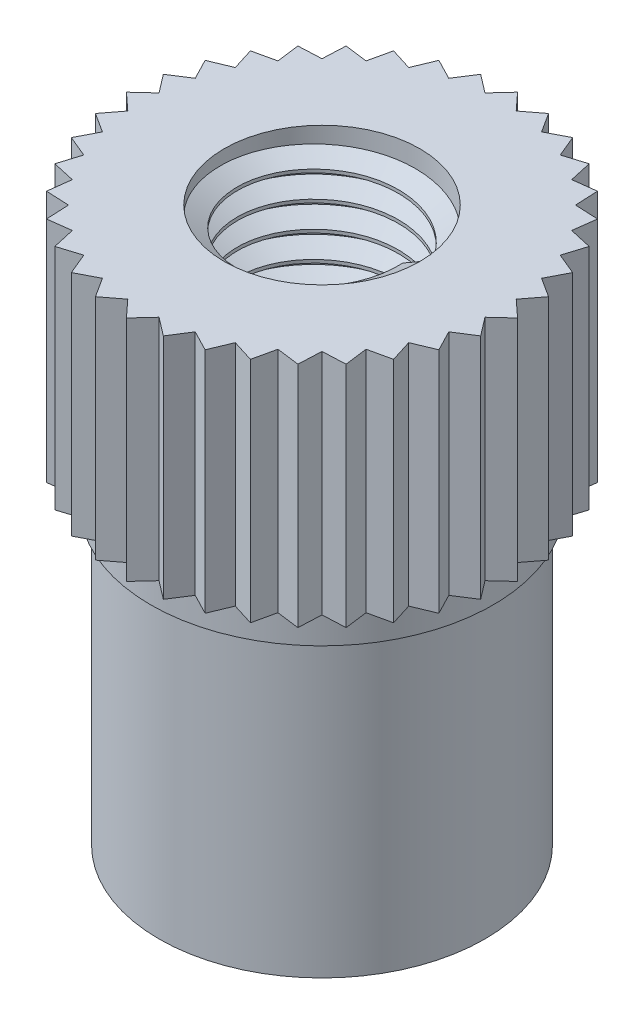
from build123d import *
from build123d.topology import SkipClean

# Parameters (mm, degrees)
CROQUIS2_R                                     = 3
SALIENTE_EXTRUIR1_DEPTH                        = 8.5
CROQUIS2_3_R                                   = 3
CROQUIS2_3_R_2                                 = 2.5
CROQUIS2_3_R_3                                 = 1.5
CORTAR_EXTRUIR1_DEPTH                          = 5
CORTAR_EXTRUIR3_DEPTH                          = 10.5
MATRIZC2_COUNT                                 = 36
CROQUIS5_R                                     = 2.625
SALIENTE_EXTRUIR2_DEPTH                        = 0.5
PERFORADOR_PARA_ROSCAR_PARA_MACHO_DE_ROS_D     = 3
PERFORADOR_PARA_ROSCAR_PARA_MACHO_DE_ROS_DEPTH = 3
BARRER1_PITCH                                  = 0.4


with BuildPart() as part:
    # Croquis2 → Saliente-Extruir1 (new body)
    with BuildSketch(Plane(origin=(0, 0, 0), x_dir=(1, 0, 0), z_dir=(0, 1, 0))):
        with Locations(Location((0, 0, 0), (0, 0, 270))):
            Circle(CROQUIS2_R)
    extrude(amount=SALIENTE_EXTRUIR1_DEPTH)

    # Croquis2<3> → Cortar-Extruir1 (cut)
    # profile 1 of 2: a face of its own
    with BuildSketch(Plane(origin=(0, 0, 0), x_dir=(1, 0, 0), z_dir=(0, 1, 0))):
        with Locations(Location((0, 0, 0), (0, 0, 270))):
            Circle(CROQUIS2_3_R)
        with Locations(Location((0, 0, 0), (0, 0, 270))):
            Circle(CROQUIS2_3_R_2, mode=Mode.SUBTRACT)
    # profile 2 of 2: a face of its own
    with BuildSketch(Plane(origin=(0, 0, 0), x_dir=(1, 0, 0), z_dir=(0, 1, 0))):
        with Locations(Location((0, 0, 0), (0, 0, 270))):
            Circle(CROQUIS2_3_R_3)
    extrude(amount=CORTAR_EXTRUIR1_DEPTH, mode=Mode.SUBTRACT)

    # Croquis4 → Cortar-Extruir3 (cut, through all)
    with BuildSketch(Plane(origin=(0, 8.5, 0), x_dir=(1, 0, 0), z_dir=(0, 1, 0))):
        with BuildLine():
            Line((-3, 0), (-2.73953542, 0.239678293))
            Line((-2.73953542, 0.239678293), (-2.954423259, 0.520944533))
            ThreePointArc((-2.954423259, 0.520944533), (-2.988584094, 0.261467228), (-3, 0))
        make_face()
    cortar_extruir3 = extrude(amount=-CORTAR_EXTRUIR3_DEPTH, mode=Mode.SUBTRACT)

    # MatrizC2: Cortar-Extruir3 ×36 about axis
    matrizc2_axis = Axis((0, 0, 0), (0, 1, 0))
    for i in range(1, MATRIZC2_COUNT):
        add(cortar_extruir3.rotate(matrizc2_axis, i * 360 / MATRIZC2_COUNT), mode=Mode.SUBTRACT)

    # Croquis5 → Saliente-Extruir2 (add)
    with BuildSketch(Plane.XZ.offset(-5)):
        with Locations(Location((0, 0, 0), (0, 0, 90))):
            Circle(CROQUIS5_R)
    extrude(amount=SALIENTE_EXTRUIR2_DEPTH)

    # Perforador para roscar para macho de roscar para M21
    with Locations(Plane(origin=(0, 8.5, 0), x_dir=(1, 0, 0), z_dir=(0, 1, 0))):
        with Locations((0, 0)):
            Hole(PERFORADOR_PARA_ROSCAR_PARA_MACHO_DE_ROS_D / 2, depth=PERFORADOR_PARA_ROSCAR_PARA_MACHO_DE_ROS_DEPTH)

    # Barrer1: the profile of Croquis16 profile screwed along a right-hand helix of 7.5 turns, 6 arcs to a turn; built about Z, then put on its axis
    with SkipClean():  # the faces are left unmerged after this step: merging them gives an invalid solid
        barrer1_z = Axis((0, 0, 0), (0, 0, 1))
        barrer1_corners = [(1.5003, 0, -0.000173205), (1.240192379, 0, 0.15), (1.240192379, 0, 0.2), (1.5003, 0, 0.350173205)]
        with BuildLine(mode=Mode.PRIVATE) as barrer1_profile:
            Line(barrer1_corners[0], barrer1_corners[1])
            Line(barrer1_corners[1], barrer1_corners[2])
            Line(barrer1_corners[2], barrer1_corners[3])
            Line(barrer1_corners[3], barrer1_corners[0])
        barrer1_cap = Face(barrer1_profile.wire())
        barrer1_turn_angles = [0, 30, 60, 90, 120, 150, 180, 210, 240, 270, 300, 330, 360]
        barrer1_turn_weights = [1, 0.8660254037844387, 1, 0.8660254037844387, 1, 0.8660254037844387, 1, 0.8660254037844387, 1, 0.8660254037844387, 1, 0.8660254037844387, 1]
        barrer1_turn_rails = [Edge.make_bspline([Vector(p[0], p[1], 0).rotate(barrer1_z, barrer1_turn_angles[k]) / barrer1_turn_weights[k] + Vector(0, 0, p[2] + BARRER1_PITCH * barrer1_turn_angles[k] / 360) for k in range(13)], [0, 0, 0, 1, 1, 2, 2, 3, 3, 4, 4, 5, 5, 6, 6, 6], 2, barrer1_turn_weights) for p in barrer1_corners]
        barrer1_turn_sides = [Face.make_surface_from_curves(barrer1_turn_rails[p[0]], barrer1_turn_rails[p[1]]) for p in [(0, 1), (1, 2), (2, 3), (3, 0)]]
        barrer1_last_angles = [2520, 2550, 2580, 2610, 2640, 2670, 2700]
        barrer1_last_weights = [1, 0.8660254037844387, 1, 0.8660254037844387, 1, 0.8660254037844526, 1]
        barrer1_last_rails = [Edge.make_bspline([Vector(p[0], p[1], 0).rotate(barrer1_z, barrer1_last_angles[k]) / barrer1_last_weights[k] + Vector(0, 0, p[2] + BARRER1_PITCH * barrer1_last_angles[k] / 360) for k in range(7)], [0, 0, 0, 1, 1, 2, 2, 3, 3, 3], 2, barrer1_last_weights) for p in barrer1_corners]
        barrer1_last_sides = [Face.make_surface_from_curves(barrer1_last_rails[p[0]], barrer1_last_rails[p[1]]) for p in [(0, 1), (1, 2), (2, 3), (3, 0)]]
        barrer1 = Plane(origin=(0, 8.5, 0), x_dir=(1, 0, 0), z_dir=(0, -1, 0)) * Solid(Shell([*[p.moved(Location((0, 0, BARRER1_PITCH * i))) for i in range(7) for p in barrer1_turn_sides], *barrer1_last_sides, barrer1_cap, barrer1_cap.rotate(barrer1_z, 2700).moved(Location((0, 0, BARRER1_PITCH * 2700 / 360)))]))
        add(barrer1)


solid = part.part
